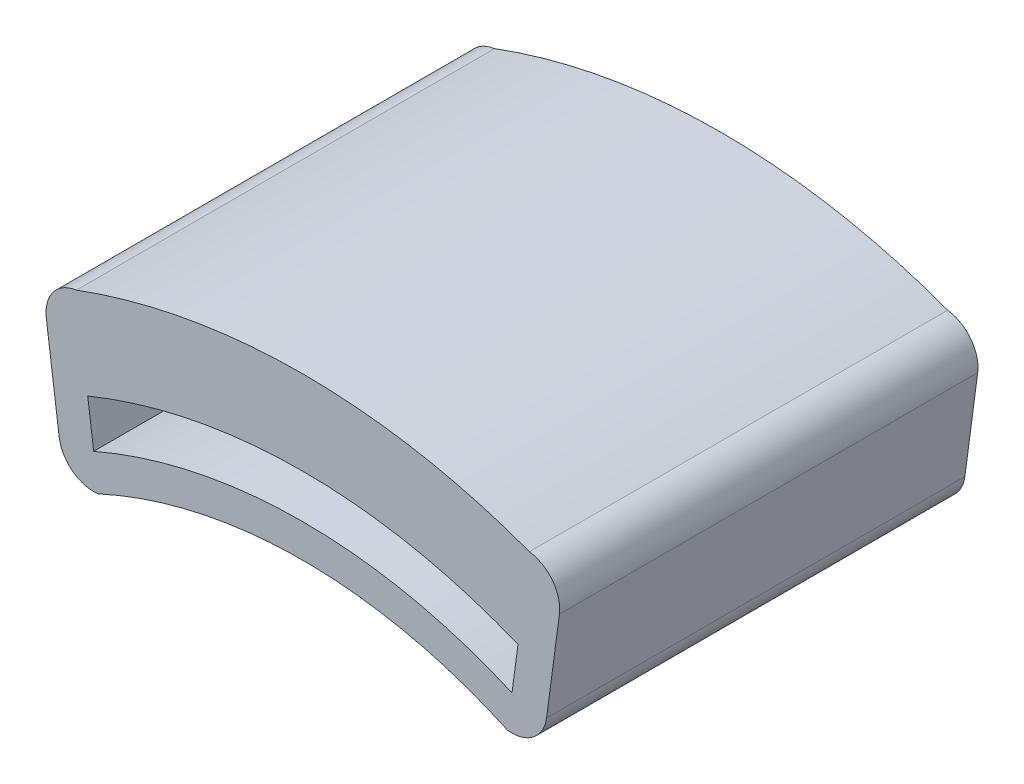
from build123d import *

# Parameters (mm, degrees)
BOSS_EXTRUDE1_DEPTH                 = 24
BOSS_EXTRUDE1_2_DEPTH               = 24
SKETCH4_R                           = 10
CUT_EXTRUDE1_DEPTH                  = 2.5
CUT_EXTRUDE1_DIRECTION_2_REACH      = 30.177
CUT_EXTRUDE1_DIRECTION_2_END_RADIUS = 32.507235283
SKETCH5_W                           = 24
SKETCH5_H                           = 9.578050903
BOSS_EXTRUDE2_DEPTH                 = 2
SKETCH6_W                           = 24
SKETCH6_H                           = 9.578050903
BOSS_EXTRUDE3_DEPTH                 = 2
FILLET1_R                           = 2


with BuildPart() as part:
    # Sketch1 → Boss-Extrude1 (new body)
    with BuildSketch(Plane.XY):
        with BuildLine():
            Line((-13, 35.007235283), (-12.343096138, 30.072717261))
            ThreePointArc((-12.343096138, 30.072717261), (0, 32.507235283), (12.343096138, 30.072717261))
            Line((12.343096138, 30.072717261), (13, 35.007235283))
            ThreePointArc((13, 35.007235283), (0, 37.343092027), (-13, 35.007235283))
        make_face()
    extrude(amount=BOSS_EXTRUDE1_DEPTH)

    # Sketch4 → Cut-Extrude1 (cut)
    with BuildSketch(Plane(origin=(0, 32.51, 0), x_dir=(1, 0, 0), z_dir=(0, 1, 0))):
        with Locations(Location((0, -12, 0), (0, 0, 270))):
            Circle(SKETCH4_R)
    extrude(amount=CUT_EXTRUDE1_DEPTH, mode=Mode.SUBTRACT)

    # Cut-Extrude1 direction 2: up to this cylinder (the profile starts outside it)
    cut_extrude1_direction_2_end = Plane(origin=(0, 0, 12), z_dir=(0, 0, -1)) * Cylinder(CUT_EXTRUDE1_DIRECTION_2_END_RADIUS, 126.368470565, mode=Mode.PRIVATE)
    # Sketch4 → Cut-Extrude1 direction 2 (cut, up to the surface)
    with BuildSketch(Plane(origin=(0, 32.51, 0), x_dir=(1, 0, 0), z_dir=(0, 1, 0)), mode=Mode.PRIVATE) as cut_extrude1_direction_2_sk1:
        with Locations(Location((0, -12, 0), (0, 0, 270))):
            Circle(SKETCH4_R)
    cut_extrude1_direction_2_tool1 = extrude(cut_extrude1_direction_2_sk1.sketch, amount=-CUT_EXTRUDE1_DIRECTION_2_REACH, mode=Mode.PRIVATE) - cut_extrude1_direction_2_end
    add(cut_extrude1_direction_2_tool1.solids().sort_by_distance((0, 32.51, 12))[0], mode=Mode.SUBTRACT)



with BuildPart() as body_2:
    # Sketch1 → Boss-Extrude1 2 (new body)
    with BuildSketch(Plane.XY):
        with BuildLine():
            Line((11.736079894, 25.5129441), (12, 27.49545417))
            ThreePointArc((12, 27.49545417), (0, 30), (-12, 27.49545417))
            Line((-12, 27.49545417), (-11.736079894, 25.5129441))
            ThreePointArc((-11.736079894, 25.5129441), (0, 28.082839741), (11.736079894, 25.5129441))
        make_face()
    extrude(amount=BOSS_EXTRUDE1_2_DEPTH)


with BuildPart() as part_1:
    add(part.part)

    add(body_2.part)  # Boss-Extrude2 merges body 2
    # Sketch5 → Boss-Extrude2 (add)
    with BuildSketch(Plane(origin=(-8.194466309, -1.090881934, 0), x_dir=(0, 0, 1), z_dir=(-0.9912550349784054, -0.13196005315988815, 0))):
        with Locations((12, 31.627553475)):
            Rectangle(SKETCH5_W, SKETCH5_H)
    extrude(amount=BOSS_EXTRUDE2_DEPTH)

    # Sketch6 → Boss-Extrude3 (add)
    with BuildSketch(Plane(origin=(8.194466309, -1.090881934, 0), x_dir=(0, 0, -1), z_dir=(0.9912550349784054, -0.13196005315988815, 0))):
        with Locations((-12, 31.627553475)):
            Rectangle(SKETCH6_W, SKETCH6_H)
    extrude(amount=BOSS_EXTRUDE3_DEPTH)

    # Fillet1
    fillet1_edges = [part_1.edges().sort_by_distance(p)[0] for p in [
        (-14.98251007, 34.743315176, 12),
        (-13.718589964, 25.249023993, 12),
        (13.718589964, 25.249023993, 12),
        (14.98251007, 34.743315176, 12),
    ]]
    fillet(fillet1_edges, radius=FILLET1_R - 0.0001)  # a hair under: the kernel refuses the full size


solid = part_1.part
